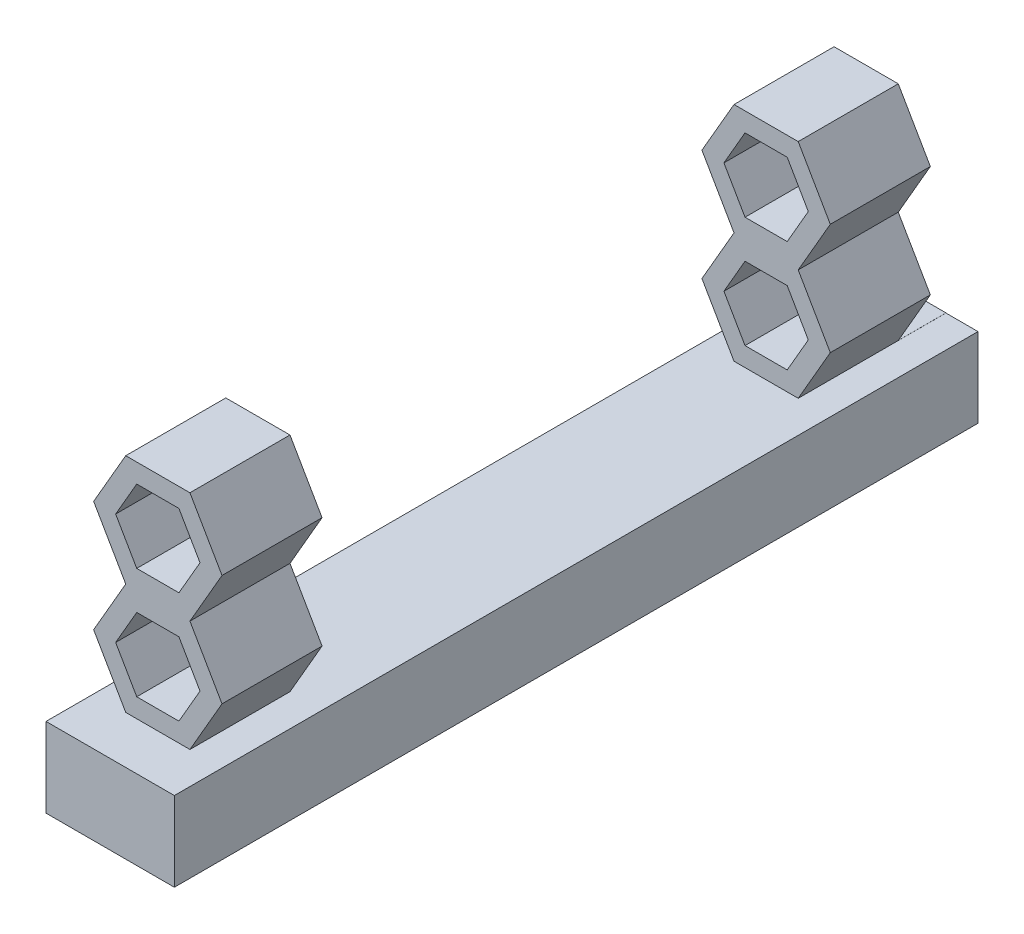
from build123d import *

# Parameters (mm, degrees)
BOSS_EXTRUDE1_DEPTH = 25.3
CUT_EXTRUDE1_DEPTH  = 25.3
SKETCH14_W          = 4.475703298
SKETCH14_H          = 7.178850836
CUT_EXTRUDE6_DEPTH  = 1.5
SKETCH15_W          = 4.041452
SKETCH15_H          = 7.107257799
CUT_EXTRUDE7_DEPTH  = 1.5
SKETCH16_W          = 5.309940562
SKETCH16_H          = 16
CUT_EXTRUDE8_DEPTH  = 7


with BuildPart() as part:
    # Sketch2 → Boss-Extrude1 (new body)
    with BuildSketch(Plane.XY):
        Polygon((3.031088942, 2.501305671), (4.041452, 2.501305671), (4.041452, 0), (0, 0), (0, 2.501305671), (1.010363, 2.501305671), (2.9e-08, 4.251305671), (1.010363, 6.001305671), (2.9e-08, 7.751305671), (1.010363, 9.501305671), (3.031088942, 9.501305671), (4.041451913, 7.751305671), (3.031088942, 6.001305671), (4.041451913, 4.251305671), align=None)
    extrude(amount=BOSS_EXTRUDE1_DEPTH)

    # Sketch3 → Cut-Extrude1 (cut)
    with BuildSketch(Plane.XY.offset(25.3)):
        Polygon((3.34863159, 7.751305671), (2.684678781, 8.901305671), (1.356773162, 8.901305671), (0.692820352, 7.751305671), (1.356773162, 6.601305671), (2.684678781, 6.601305671), align=None)
        Polygon((3.34863159, 4.251305671), (2.684678781, 5.401305671), (1.356773162, 5.401305671), (0.692820352, 4.251305671), (1.356773162, 3.101305671), (2.684678781, 3.101305671), align=None)
    extrude(amount=-CUT_EXTRUDE1_DEPTH, mode=Mode.SUBTRACT)

    # Sketch14 → Cut-Extrude6 (cut)
    with BuildSketch(Plane(origin=(0, 0, 0), x_dir=(-1, 0, 0), z_dir=(0, 0, -1))):
        with Locations((-1.998569053, 6.096687367)):
            Rectangle(SKETCH14_W, SKETCH14_H)
    extrude(amount=-CUT_EXTRUDE6_DEPTH, mode=Mode.SUBTRACT)

    # Sketch15 → Cut-Extrude7 (cut)
    with BuildSketch(Plane.XY.offset(25.3)):
        with Locations((2.020726, 6.054934571)):
            Rectangle(SKETCH15_W, SKETCH15_H)
    extrude(amount=-CUT_EXTRUDE7_DEPTH, mode=Mode.SUBTRACT)

    # Sketch16 → Cut-Extrude8 (cut)
    with BuildSketch(Plane(origin=(0, 9.501305671, 0), x_dir=(1, 0, 0), z_dir=(0, 1, 0))):
        with Locations((1.902727321, -12.65)):
            Rectangle(SKETCH16_W, SKETCH16_H)
    extrude(amount=-CUT_EXTRUDE8_DEPTH, mode=Mode.SUBTRACT)


solid = part.part
